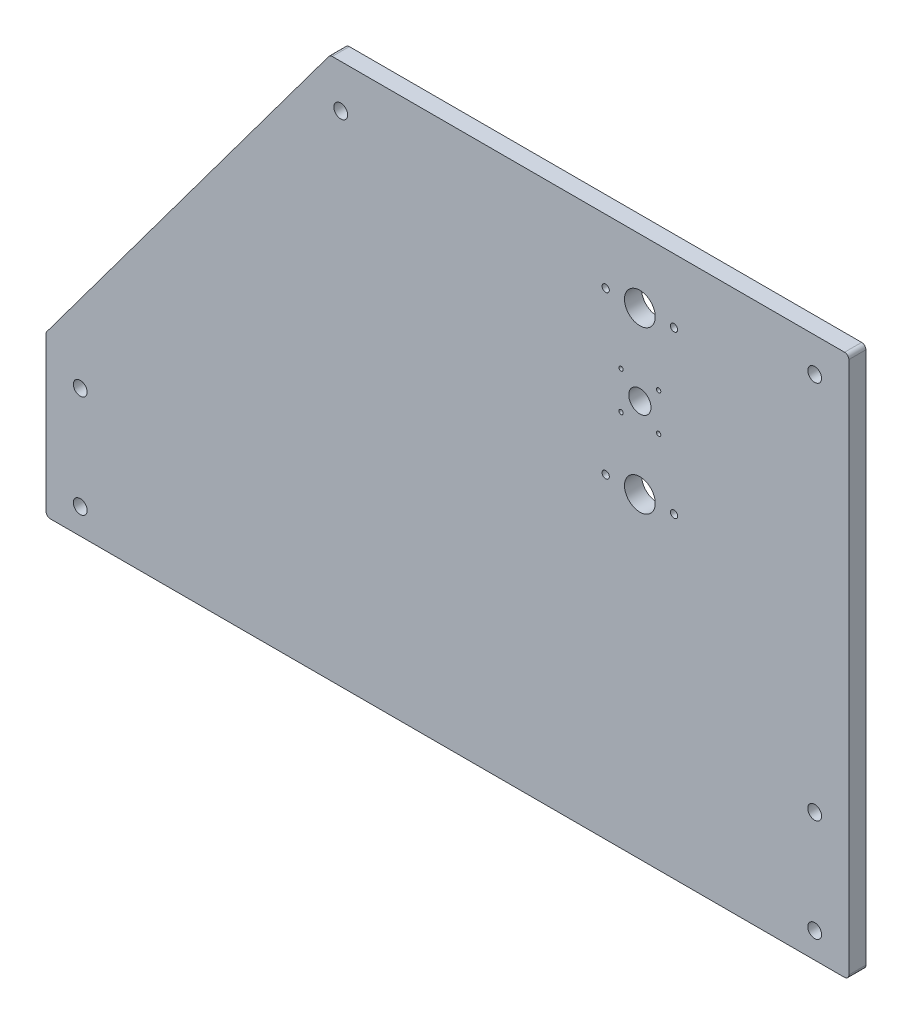
from build123d import *

# Parameters (mm, degrees)
SKETCH2_W             = 470
SKETCH2_H             = 317
BOSS_EXTRUDE1_DEPTH   = 5
SKETCH3_R             = 4.05
CUT_EXTRUDE1_DEPTH    = 10
SKETCH4_R             = 9
CUT_EXTRUDE2_DEPTH    = 284.632244288
M5X0_8_TAPPED_HOLE1_D = 4.2
SKETCH11_R            = 6.5
CUT_EXTRUDE9_DEPTH    = 284.632244288
M3X0_5_TAPPED_HOLE1_D = 2.5
FILLET2_R             = 2.5
CUT_EXTRUDE14_DEPTH   = 284.632244288
FILLET3_R             = 2.5
SKETCH27_R            = 4.05
CUT_EXTRUDE15_DEPTH   = 284.632244288


with BuildPart() as part:
    # Sketch2 → Boss-Extrude1 (new, symmetric)
    with BuildSketch(Plane.XY):
        Rectangle(SKETCH2_W, SKETCH2_H)
    extrude(amount=BOSS_EXTRUDE1_DEPTH, both=True)

    # Sketch3 → Cut-Extrude1 (cut)
    with BuildSketch(Plane.XY.offset(5)):
        with Locations((-215, -83.5)):
            Circle(SKETCH3_R)
        with Locations((-215, -143.5)):
            Circle(SKETCH3_R)
        with Locations((215, -143.5)):
            Circle(SKETCH3_R)
        with Locations((-62.5, 133.34)):
            Circle(SKETCH3_R)
        with Locations((215, 138.5)):
            Circle(SKETCH3_R)
    extrude(amount=-CUT_EXTRUDE1_DEPTH, mode=Mode.SUBTRACT)

    # Sketch4 → Cut-Extrude2 (cut, through all)
    with BuildSketch(Plane.XY.offset(5)):
        with Locations((112.65, 121)):
            Circle(SKETCH4_R)
        with Locations((112.65, 26.5)):
            Circle(SKETCH4_R)
    extrude(amount=-CUT_EXTRUDE2_DEPTH, mode=Mode.SUBTRACT)

    # M5x0.8 Tapped Hole1 (through all)
    with Locations(Plane.XY.offset(5)):
        with Locations((132.65, 121), (92.65, 121), (92.65, 26.5), (132.65, 26.5)):
            Hole(M5X0_8_TAPPED_HOLE1_D / 2)

    # Sketch11 → Cut-Extrude9 (cut, through all)
    with BuildSketch(Plane.XY.offset(5)):
        with Locations((112.65, 73.75)):
            Circle(SKETCH11_R)
    extrude(amount=-CUT_EXTRUDE9_DEPTH, mode=Mode.SUBTRACT)

    # M3x0.5 Tapped Hole1 (through all)
    with Locations(Plane.XY.offset(5)):
        with Locations((101.65, 84.75), (123.65, 84.75), (123.65, 62.75), (101.65, 62.75)):
            Hole(M3X0_5_TAPPED_HOLE1_D / 2)

    # Fillet2
    fillet2_edges = [part.edges().sort_by_distance(p)[0] for p in [
        (-235, -158.5, 0),
        (235, -158.5, 0),
        (235, 158.5, 0),
        (-235, 158.5, 0),
    ]]
    fillet(fillet2_edges, radius=FILLET2_R)

    # Sketch26 → Cut-Extrude14 (cut, through all)
    with BuildSketch(Plane.XY.offset(5)):
        Polygon((-41.179771375, 195.539246498), (-255.237491093, -92.386983266), (-255.237491093, 252.027212172), align=None)
    extrude(amount=-CUT_EXTRUDE14_DEPTH, mode=Mode.SUBTRACT)

    # Fillet3
    fillet3_edges = [part.edges().sort_by_distance(p)[0] for p in [
        (-235, -65.165799569, 0),
        (-68.716465938, 158.5, 0),
    ]]
    fillet(fillet3_edges, radius=FILLET3_R)

    # Sketch27 → Cut-Extrude15 (cut, through all)
    with BuildSketch(Plane.XY.offset(5)):
        with Locations((215, -83.5)):
            Circle(SKETCH27_R)
    extrude(amount=-CUT_EXTRUDE15_DEPTH, mode=Mode.SUBTRACT)


solid = part.part
